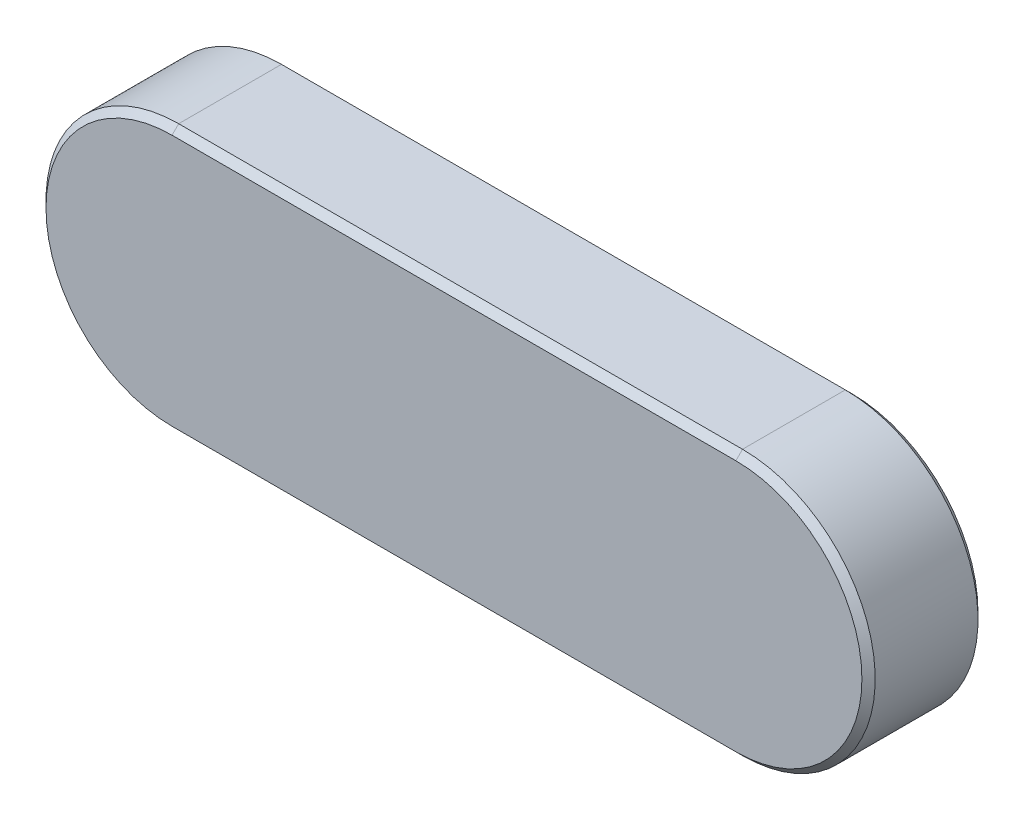
from build123d import *

# Parameters (mm, degrees)
BASEKEY_DEPTH = 3.5
CHAMFER1_SIZE = 0.4


with BuildPart() as part:
    # Sketch1 → BaseKey (new, symmetric)
    with BuildSketch(Plane.XY):
        with BuildLine():
            Line((-17, 8), (17, 8))
            ThreePointArc((17, 8), (25, 0), (17, -8))
            Line((17, -8), (-17, -8))
            ThreePointArc((-17, -8), (-25, 0), (-17, 8))
        make_face()
    extrude(amount=BASEKEY_DEPTH, both=True)

    # Chamfer1
    chamfer1_edges = [part.edges().sort_by_distance(p)[0] for p in [
        (0, 8, 3.5),
        (0, 8, -3.5),
        (0, -8, -3.5),
        (0, -8, 3.5),
        (-25, 0, -3.5),
        (25, 0, -3.5),
        (-25, 0, 3.5),
        (25, 0, 3.5),
    ]]
    chamfer(chamfer1_edges, length=CHAMFER1_SIZE)


solid = part.part
